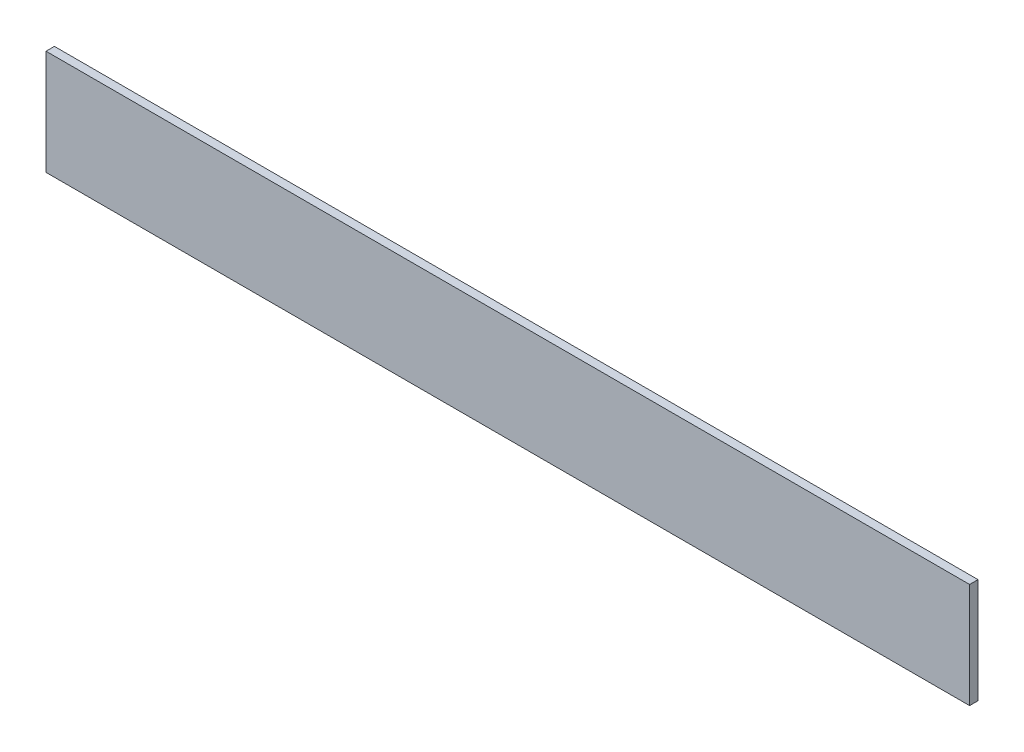
from build123d import *

# Parameters (mm, degrees)
EXTRUDE_1_DEPTH     = 220
SKETCH_2_W          = 23
SKETCH_2_H          = 23
CUT_EXTRUDE_1_DEPTH = 223.822799552


with BuildPart() as part:
    # Эскиз1 → Вытянуть-Тонкостенный1 (new body)
    with BuildSketch(Plane(origin=(0, 0, 0), x_dir=(0, 0, -1), z_dir=(1, 0, 0))):
        Polygon((0, 25), (0, 0), (25, 0), (25, 2), (2, 2), (2, 25), align=None)
    extrude(amount=EXTRUDE_1_DEPTH)

    # Эскиз2 → Вырез-Вытянуть1 (cut, through all)
    with BuildSketch(Plane.XZ):
        with Locations((208.5, -13.5)):
            Rectangle(SKETCH_2_W, SKETCH_2_H)
    extrude(amount=-CUT_EXTRUDE_1_DEPTH, mode=Mode.SUBTRACT)


solid = part.part
